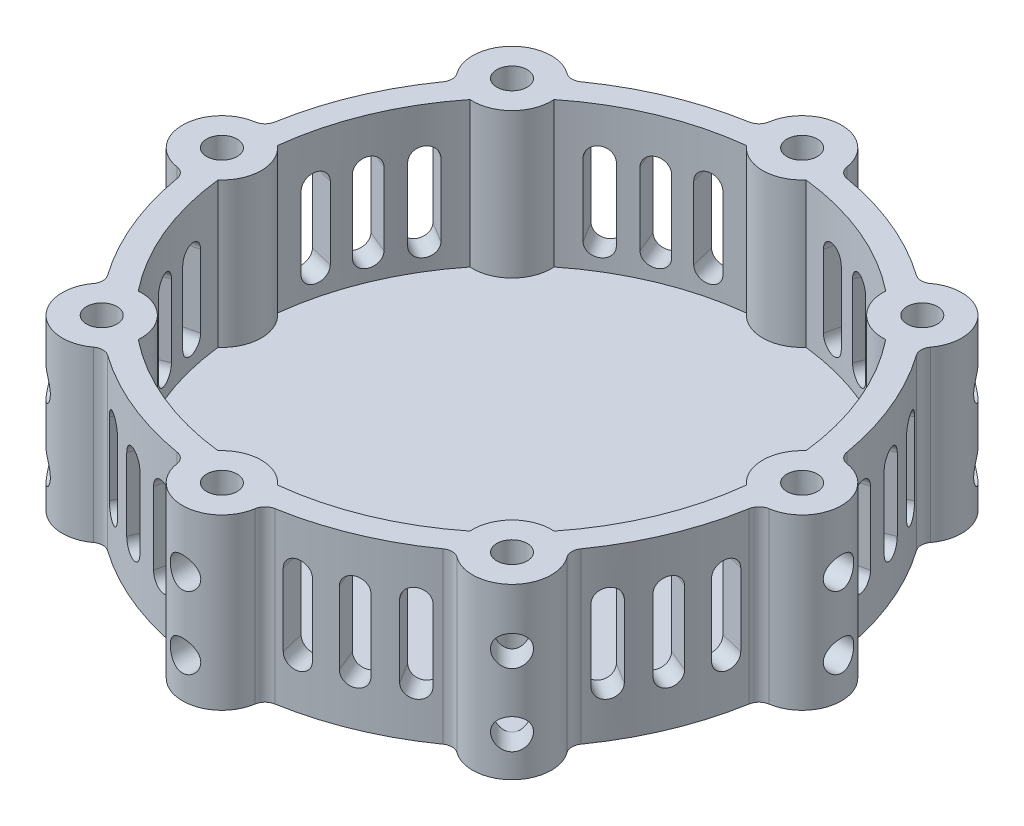
from build123d import *

# Parameters (mm, degrees)
BOSS_EXTRUDE1_DEPTH                 = 6.35
BOSS_EXTRUDE2_DEPTH                 = 38.1
CUT_EXTRUDE4_DEPTH                  = 15.999999877
CIRPATTERN6_COUNT                   = 8
CUT_EXTRUDE5_REACH                  = 196.514
CUT_EXTRUDE5_END_RADIUS             = 69.85
CUT_EXTRUDE5_DIRECTION_2_REACH      = 196.514
CUT_EXTRUDE5_DIRECTION_2_END_RADIUS = 76.2
CIRPATTERN7_COUNT                   = 2
CIRPATTERN7_ANGLE                   = 9
CIRPATTERN7_THE_OTHER_WAY_COUNT     = 2
CIRPATTERN7_THE_OTHER_WAY_ANGLE     = 9
CIRPATTERN8_START                   = 69.398331616
CIRPATTERN8_DEPTH                   = 7.601668384
CIRPATTERN8_START_2                 = 68.973146063
CIRPATTERN8_2_DEPTH                 = 8.026853937
CIRPATTERN8_START_3                 = 69.006751978
CIRPATTERN8_3_DEPTH                 = 7.993248022
CIRPATTERN8_START_4                 = -77
CIRPATTERN8_4_DEPTH                 = 154
CIRPATTERN8_5_DEPTH                 = 154
CIRPATTERN8_6_DEPTH                 = 154
CIRPATTERN8_7_DEPTH                 = 154
CIRPATTERN8_8_DEPTH                 = 154
CIRPATTERN8_9_DEPTH                 = 154
CIRPATTERN8_10_DEPTH                = 154
CIRPATTERN8_11_DEPTH                = 154
CIRPATTERN8_12_DEPTH                = 154


with BuildPart() as part:
    # Sketch9 → Boss-Extrude1 (new body)
    with BuildSketch(Plane(origin=(0, 0, 0), x_dir=(1, 0, 0), z_dir=(0, 1, 0))):
        with BuildLine():
            ThreePointArc((-10.231491372, 77.761756808), (-11.105207378, 76.015825656), (-12.835331785, 75.111212598))
            ThreePointArc((-12.835331785, 75.111212598), (-29.160477551, 70.399620375), (-44.035697637, 62.187597908))
            ThreePointArc((-44.035697637, 62.187597908), (-45.898738361, 61.603873243), (-47.751108625, 62.220622487))
            ThreePointArc((-47.751108625, 62.220622487), (-61.200091912, 61.200091912), (-62.220622487, 47.751108625))
            ThreePointArc((-62.220622487, 47.751108625), (-61.761905691, 46.860108439), (-61.603747828, 45.870518362))
            ThreePointArc((-61.603747828, 45.870518362), (-61.753229197, 44.907781631), (-62.187597915, 44.035697628))
            ThreePointArc((-62.187597915, 44.035697628), (-70.399620377, 29.160477547), (-75.111212598, 12.835331786))
            ThreePointArc((-75.111212598, 12.835331786), (-76.015825656, 11.105207379), (-77.761756808, 10.231491372))
            ThreePointArc((-77.761756808, 10.231491372), (-86.550000001, 0), (-77.761756808, -10.231491372))
            ThreePointArc((-77.761756808, -10.231491372), (-76.015825656, -11.105207378), (-75.111212598, -12.835331785))
            ThreePointArc((-75.111212598, -12.835331785), (-70.399620371, -29.160477561), (-62.187597896, -44.035697654))
            ThreePointArc((-62.187597896, -44.035697654), (-61.753229192, -44.907781647), (-61.603747828, -45.870518362))
            ThreePointArc((-61.603747828, -45.870518362), (-61.761905691, -46.860108439), (-62.220622487, -47.751108625))
            ThreePointArc((-62.220622487, -47.751108625), (-61.200091912, -61.200091912), (-47.751108625, -62.220622487))
            ThreePointArc((-47.751108625, -62.220622487), (-45.898738355, -61.603873243), (-44.035697628, -62.187597915))
            ThreePointArc((-44.035697628, -62.187597915), (-29.160477591, -70.399620359), (-12.83533188, -75.111212582))
            ThreePointArc((-12.83533188, -75.111212582), (-11.105207412, -76.015825622), (-10.231491372, -77.761756808))
            ThreePointArc((-10.231491372, -77.761756808), (0, -86.550000001), (10.231491372, -77.761756808))
            ThreePointArc((10.231491372, -77.761756808), (11.105207378, -76.015825656), (12.835331785, -75.111212598))
            ThreePointArc((12.835331785, -75.111212598), (29.160477513, -70.399620391), (44.035697569, -62.187597956))
            ThreePointArc((44.035697569, -62.187597956), (45.89873832, -61.603873243), (47.751108625, -62.220622487))
            ThreePointArc((47.751108625, -62.220622487), (61.200091912, -61.200091912), (62.220622487, -47.751108625))
            ThreePointArc((62.220622487, -47.751108625), (61.603873243, -45.898738355), (62.187597915, -44.035697628))
            ThreePointArc((62.187597915, -44.035697628), (70.399620388, -29.160477522), (75.111212607, -12.835331732))
            ThreePointArc((75.111212607, -12.835331732), (76.015825675, -11.10520736), (77.761756808, -10.231491372))
            ThreePointArc((77.761756808, -10.231491372), (86.550000001, 0), (77.761756808, 10.231491372))
            ThreePointArc((77.761756808, 10.231491372), (76.015825656, 11.105207378), (75.111212598, 12.835331785))
            ThreePointArc((75.111212598, 12.835331785), (70.3996203, 29.160477734), (62.18759768, 44.03569796))
            ThreePointArc((62.18759768, 44.03569796), (61.603873245, 45.898738559), (62.220622487, 47.751108625))
            ThreePointArc((62.220622487, 47.751108625), (61.200091912, 61.200091912), (47.751108625, 62.220622487))
            ThreePointArc((47.751108625, 62.220622487), (45.898738355, 61.603873243), (44.035697628, 62.187597915))
            ThreePointArc((44.035697628, 62.187597915), (29.160477452, 70.399620416), (12.835331584, 75.111212632))
            ThreePointArc((12.835331584, 75.111212632), (11.105207307, 76.015825729), (10.231491372, 77.761756808))
            ThreePointArc((10.231491372, 77.761756808), (0, 86.550000001), (-10.231491372, 77.761756808))
        make_face()
    extrude(amount=BOSS_EXTRUDE1_DEPTH)

    # Sketch10 → Boss-Extrude2 (add)
    with BuildSketch(Plane(origin=(0, 6.35, 0), x_dir=(1, 0, 0), z_dir=(0, 1, 0))):
        with BuildLine():
            ThreePointArc((-10.231491372, 77.761756808), (-11.105207378, 76.015825656), (-12.835331785, 75.111212598))
            ThreePointArc((-12.835331785, 75.111212598), (-29.160477551, 70.399620375), (-44.035697637, 62.187597908))
            ThreePointArc((-44.035697637, 62.187597908), (-45.898738361, 61.603873243), (-47.751108625, 62.220622487))
            ThreePointArc((-47.751108625, 62.220622487), (-61.200091912, 61.200091912), (-62.220622487, 47.751108625))
            ThreePointArc((-62.220622487, 47.751108625), (-61.761905691, 46.860108439), (-61.603747828, 45.870518362))
            ThreePointArc((-61.603747828, 45.870518362), (-61.753229197, 44.907781631), (-62.187597915, 44.035697628))
            ThreePointArc((-62.187597915, 44.035697628), (-70.399620377, 29.160477547), (-75.111212598, 12.835331786))
            ThreePointArc((-75.111212598, 12.835331786), (-76.015825656, 11.105207379), (-77.761756808, 10.231491372))
            ThreePointArc((-77.761756808, 10.231491372), (-86.550000001, 0), (-77.761756808, -10.231491372))
            ThreePointArc((-77.761756808, -10.231491372), (-76.015825656, -11.105207378), (-75.111212598, -12.835331785))
            ThreePointArc((-75.111212598, -12.835331785), (-70.399620375, -29.160477553), (-62.187597907, -44.035697639))
            ThreePointArc((-62.187597907, -44.035697639), (-61.753229195, -44.907781638), (-61.603747828, -45.870518362))
            ThreePointArc((-61.603747828, -45.870518362), (-61.761905691, -46.860108439), (-62.220622487, -47.751108625))
            ThreePointArc((-62.220622487, -47.751108625), (-61.200091912, -61.200091912), (-47.751108625, -62.220622487))
            ThreePointArc((-47.751108625, -62.220622487), (-45.898738355, -61.603873243), (-44.035697628, -62.187597915))
            ThreePointArc((-44.035697628, -62.187597915), (-29.160477591, -70.399620359), (-12.83533188, -75.111212582))
            ThreePointArc((-12.83533188, -75.111212582), (-11.105207412, -76.015825622), (-10.231491372, -77.761756808))
            ThreePointArc((-10.231491372, -77.761756808), (0, -86.550000001), (10.231491372, -77.761756808))
            ThreePointArc((10.231491372, -77.761756808), (11.105207378, -76.015825656), (12.835331785, -75.111212598))
            ThreePointArc((12.835331785, -75.111212598), (29.160477555, -70.399620374), (44.035697643, -62.187597904))
            ThreePointArc((44.035697643, -62.187597904), (45.898738364, -61.603873243), (47.751108625, -62.220622487))
            ThreePointArc((47.751108625, -62.220622487), (61.200091912, -61.200091912), (62.220622487, -47.751108625))
            ThreePointArc((62.220622487, -47.751108625), (61.603873243, -45.898738355), (62.187597915, -44.035697628))
            ThreePointArc((62.187597915, -44.035697628), (70.399620388, -29.160477522), (75.111212607, -12.835331732))
            ThreePointArc((75.111212607, -12.835331732), (76.015825675, -11.10520736), (77.761756808, -10.231491372))
            ThreePointArc((77.761756808, -10.231491372), (86.550000001, 0), (77.761756808, 10.231491372))
            ThreePointArc((77.761756808, 10.231491372), (76.015825656, 11.105207378), (75.111212598, 12.835331785))
            ThreePointArc((75.111212598, 12.835331785), (70.399620392, 29.160477512), (62.187597958, 44.035697567))
            ThreePointArc((62.187597958, 44.035697567), (61.603873243, 45.898738318), (62.220622487, 47.751108625))
            ThreePointArc((62.220622487, 47.751108625), (61.200091912, 61.200091912), (47.751108625, 62.220622487))
            ThreePointArc((47.751108625, 62.220622487), (45.898738355, 61.603873243), (44.035697628, 62.187597915))
            ThreePointArc((44.035697628, 62.187597915), (29.160477452, 70.399620416), (12.835331584, 75.111212632))
            ThreePointArc((12.835331584, 75.111212632), (11.105207307, 76.015825729), (10.231491372, 77.761756808))
            ThreePointArc((10.231491372, 77.761756808), (0, 86.550000001), (-10.231491372, 77.761756808))
        make_face()
        with BuildLine():
            ThreePointArc((-49.881536725, -53.881536726), (-55.460640405, -57.556646464), (-56.634752514, -50.979847074))
            ThreePointArc((-56.634752514, -50.979847074), (-52.302433048, -50.206426989), (-49.881536725, -53.881536726))
        make_face(mode=Mode.SUBTRACT)
        with BuildLine():
            ThreePointArc((4.000000001, -76.2), (-0.05249796, -80.199655482), (-3.998621983, -76.095013123))
            ThreePointArc((-3.998621983, -76.095013123), (0.05249796, -72.200344518), (4.000000001, -76.2))
        make_face(mode=Mode.SUBTRACT)
        with BuildLine():
            ThreePointArc((57.881536727, -53.881536726), (55.363636824, -57.596826663), (50.979847074, -56.634752514))
            ThreePointArc((50.979847074, -56.634752514), (52.399436629, -50.16624679), (57.881536727, -53.881536726))
        make_face(mode=Mode.SUBTRACT)
        with BuildLine():
            ThreePointArc((-43.556923847, 54.606015099), (-26.730437751, 64.532985346), (-7.81288735, 69.41167979))
            ThreePointArc((-7.81288735, 69.41167979), (0, 65.849999999), (7.81288735, 69.41167979))
            ThreePointArc((7.81288735, 69.41167979), (26.730437751, 64.532985346), (43.556923847, 54.606015099))
            ThreePointArc((43.556923847, 54.606015099), (46.56298154, 46.56298154), (54.606015099, 43.556923847))
            ThreePointArc((54.606015099, 43.556923847), (64.532985346, 26.730437751), (69.41167979, 7.81288735))
            ThreePointArc((69.41167979, 7.81288735), (65.849999999, 0), (69.41167979, -7.81288735))
            ThreePointArc((69.41167979, -7.81288735), (64.532985346, -26.730437751), (54.606015099, -43.556923847))
            ThreePointArc((54.606015099, -43.556923847), (46.56298154, -46.56298154), (43.556923847, -54.606015099))
            ThreePointArc((43.556923847, -54.606015099), (26.730437751, -64.532985346), (7.81288735, -69.41167979))
            ThreePointArc((7.81288735, -69.41167979), (0, -65.849999999), (-7.81288735, -69.41167979))
            ThreePointArc((-7.81288735, -69.41167979), (-26.730437751, -64.532985346), (-43.556923847, -54.606015099))
            ThreePointArc((-43.556923847, -54.606015099), (-46.56298154, -46.56298154), (-54.606015099, -43.556923847))
            ThreePointArc((-54.606015099, -43.556923847), (-64.532985346, -26.730437751), (-69.41167979, -7.81288735))
            ThreePointArc((-69.41167979, -7.81288735), (-65.849999999, 0), (-69.41167979, 7.81288735))
            ThreePointArc((-69.41167979, 7.81288735), (-64.532985346, 26.730437751), (-54.606015099, 43.556923847))
            ThreePointArc((-54.606015099, 43.556923847), (-46.56298154, 46.56298154), (-43.556923847, 54.606015099))
        make_face(mode=Mode.SUBTRACT)
        with BuildLine():
            ThreePointArc((80.200000001, 0), (78.99106185, -2.865305177), (76.095013123, -3.998621983))
            ThreePointArc((76.095013123, -3.998621983), (73.40893815, 2.865305177), (80.200000001, 0))
        make_face(mode=Mode.SUBTRACT)
        with BuildLine():
            ThreePointArc((-72.199999999, 0), (-79.065305177, -2.79106185), (-76.095013123, 3.998621983))
            ThreePointArc((-76.095013123, 3.998621983), (-73.334694823, 2.79106185), (-72.199999999, 0))
        make_face(mode=Mode.SUBTRACT)
        with BuildLine():
            ThreePointArc((-49.881536725, 53.881536726), (-57.596826663, 52.399436629), (-50.979847074, 56.634752514))
            ThreePointArc((-50.979847074, 56.634752514), (-50.16624679, 55.363636824), (-49.881536725, 53.881536726))
        make_face(mode=Mode.SUBTRACT)
        with BuildLine():
            ThreePointArc((4.000000001, 76.2), (3.999655482, 76.14750204), (3.998621983, 76.095013123))
            ThreePointArc((3.998621983, 76.095013123), (-3.999655482, 76.25249796), (4.000000001, 76.2))
        make_face(mode=Mode.SUBTRACT)
        with BuildLine():
            ThreePointArc((57.881536727, 53.881536726), (57.556646464, 52.302433048), (56.634752514, 50.979847074))
            ThreePointArc((56.634752514, 50.979847074), (50.206426989, 55.460640405), (57.881536727, 53.881536726))
        make_face(mode=Mode.SUBTRACT)
    extrude(amount=BOSS_EXTRUDE2_DEPTH)

    # Sketch13 → Cut-Extrude4 (cut)
    with BuildSketch(Plane.XY.offset(-86.550000001)):
        with BuildLine():
            ThreePointArc((0, 33.274999998), (-4.000000001, 29.274999997), (0, 25.274999996))
            Line((0, 25.274999996), (0, 33.274999998))
        make_face()
        with BuildLine():
            Line((0, 33.274999998), (0, 25.274999996))
            ThreePointArc((0, 25.274999996), (2.828427125, 26.446572872), (4.000000001, 29.274999997))
            ThreePointArc((4.000000001, 29.274999997), (2.828427125, 32.103427122), (0, 33.274999998))
        make_face()
        with BuildLine():
            ThreePointArc((0, 14.350000002), (-4.000000001, 10.350000001), (0, 6.35))
            Line((0, 6.35), (0, 14.350000002))
        make_face()
        with BuildLine():
            Line((0, 14.350000002), (0, 6.35))
            ThreePointArc((0, 6.35), (2.828427125, 7.521572876), (4.000000001, 10.350000001))
            ThreePointArc((4.000000001, 10.350000001), (2.828427125, 13.178427126), (0, 14.350000002))
        make_face()
    cut_extrude4 = extrude(amount=CUT_EXTRUDE4_DEPTH, mode=Mode.SUBTRACT)

    # CirPattern6: Cut-Extrude4 ×8 about axis
    cirpattern6_axis = Axis((0, 44.45, 0), (0, -1, 0))
    for i in range(1, CIRPATTERN6_COUNT):
        add(cut_extrude4.rotate(cirpattern6_axis, i * 360 / CIRPATTERN6_COUNT), mode=Mode.SUBTRACT)

    # Cut-Extrude5: up to this cylinder (the profile starts outside it)
    cut_extrude5_end = Plane(origin=(0, 22.225, 0), z_dir=(0, -1, 0)) * Cylinder(CUT_EXTRUDE5_END_RADIUS, 533.728, mode=Mode.PRIVATE)
    # Sketch17 → Cut-Extrude5 (cut, up to the surface)
    with BuildSketch(Plane(origin=(-26.940768363, 0, -65.040768363), x_dir=(-0.9238795325112878, 0, 0.3826834323650873), z_dir=(-0.3826834323650873, 0, -0.9238795325112878)), mode=Mode.PRIVATE) as cut_extrude5_sk1:
        with BuildLine():
            Line((-3.175, 12.7), (-3.175, 31.75))
            ThreePointArc((-3.175, 31.75), (0, 34.925), (3.175, 31.75))
            Line((3.175, 31.75), (3.175, 12.7))
            ThreePointArc((3.175, 12.7), (0, 9.525), (-3.175, 12.7))
        make_face()
    cut_extrude5_tool1 = extrude(cut_extrude5_sk1.sketch, amount=-CUT_EXTRUDE5_REACH, mode=Mode.PRIVATE) - cut_extrude5_end
    cut_extrude5 = cut_extrude5_tool1.solids().sort_by_distance((-26.940768, 22.225, -65.040768))[0]
    add(cut_extrude5, mode=Mode.SUBTRACT)

    # Cut-Extrude5 direction 2: up to this cylinder (the profile starts inside it)
    cut_extrude5_direction_2_end = Plane(origin=(0, 22.225, 0), z_dir=(0, -1, 0)) * Cylinder(CUT_EXTRUDE5_DIRECTION_2_END_RADIUS, 546.428, mode=Mode.PRIVATE)
    # Sketch17 → Cut-Extrude5 direction 2 (cut, up to the surface)
    with BuildSketch(Plane(origin=(-26.940768363, 0, -65.040768363), x_dir=(-0.9238795325112878, 0, 0.3826834323650873), z_dir=(-0.3826834323650873, 0, -0.9238795325112878)), mode=Mode.PRIVATE) as cut_extrude5_direction_2_sk1:
        with BuildLine():
            Line((-3.175, 12.7), (-3.175, 31.75))
            ThreePointArc((-3.175, 31.75), (0, 34.925), (3.175, 31.75))
            Line((3.175, 31.75), (3.175, 12.7))
            ThreePointArc((3.175, 12.7), (0, 9.525), (-3.175, 12.7))
        make_face()
    cut_extrude5_direction_2_tool1 = extrude(cut_extrude5_direction_2_sk1.sketch, amount=CUT_EXTRUDE5_DIRECTION_2_REACH, mode=Mode.PRIVATE) & cut_extrude5_direction_2_end
    cut_extrude5_direction_2 = cut_extrude5_direction_2_tool1.solids().sort_by_distance((-26.940768, 22.225, -65.040768))[0]
    add(cut_extrude5_direction_2, mode=Mode.SUBTRACT)
    cut_extrude5 = cut_extrude5 + cut_extrude5_direction_2  # both directions under the feature's name, for the pattern or mirror that repeats it

    # CirPattern7: Cut-Extrude5 ×2 about axis
    cirpattern7_axis = Axis((0, 44.45, 0), (0, -1, 0))
    for i in range(1, CIRPATTERN7_COUNT):
        add(cut_extrude5.rotate(cirpattern7_axis, i * CIRPATTERN7_ANGLE / (CIRPATTERN7_COUNT - 1)), mode=Mode.SUBTRACT)

    # CirPattern7 the other way: Cut-Extrude5 ×2 about axis
    cirpattern7_the_other_way_axis = Axis((0, 44.45, 0), (0, 1, 0))
    for i in range(1, CIRPATTERN7_THE_OTHER_WAY_COUNT):
        add(cut_extrude5.rotate(cirpattern7_the_other_way_axis, i * CIRPATTERN7_THE_OTHER_WAY_ANGLE / (CIRPATTERN7_THE_OTHER_WAY_COUNT - 1)), mode=Mode.SUBTRACT)

    # CirPattern8: read off the stored shape, not the designer's step
    # CirPattern8 outline → CirPattern8 (cut)
    with BuildSketch(Plane(origin=(0, 0, 0), x_dir=(0.923879532511288, 0, -0.38268343236508706), z_dir=(0.382683432365087, 0, 0.923879532511288)).offset(CIRPATTERN8_START)):
        with BuildLine():
            ThreePointArc((-3.175, 12.7), (0, 9.525), (3.175, 12.7))
            Line((3.175, 12.7), (3.175, 31.75))
            ThreePointArc((3.175, 31.75), (0, 34.925), (-3.175, 31.75))
            Line((-3.175, 31.75), (-3.175, 12.7))
        make_face()
    extrude(amount=CIRPATTERN8_DEPTH, mode=Mode.SUBTRACT)

    # CirPattern8 2 outline → CirPattern8 2 (cut)
    with BuildSketch(Plane(origin=(0, 0, 0), x_dir=(0.8526401643540932, 0, -0.5224985647159472), z_dir=(0.5224985647159472, 0, 0.8526401643540933)).offset(CIRPATTERN8_START_2)):
        with BuildLine():
            ThreePointArc((-3.175, 12.7), (0, 9.525), (3.175, 12.7))
            Line((3.175, 12.7), (3.175, 31.75))
            ThreePointArc((3.175, 31.75), (0, 34.925), (-3.175, 31.75))
            Line((-3.175, 31.75), (-3.175, 12.7))
        make_face()
    extrude(amount=CIRPATTERN8_2_DEPTH, mode=Mode.SUBTRACT)

    # CirPattern8 3 outline → CirPattern8 3 (cut)
    with BuildSketch(Plane(origin=(0, 0, 0), x_dir=(0.9723699203976774, 0, -0.23344536385590214), z_dir=(0.23344536385590212, 0, 0.9723699203976774)).offset(CIRPATTERN8_START_3)):
        with BuildLine():
            ThreePointArc((-3.175, 12.7), (0, 9.525), (3.175, 12.7))
            Line((3.175, 12.7), (3.175, 31.75))
            ThreePointArc((3.175, 31.75), (0, 34.925), (-3.175, 31.75))
            Line((-3.175, 31.75), (-3.175, 12.7))
        make_face()
    extrude(amount=CIRPATTERN8_3_DEPTH, mode=Mode.SUBTRACT)

    # CirPattern8 4 outline → CirPattern8 4 (cut)
    with BuildSketch(Plane(origin=(0, 0, 0), x_dir=(0.9238795325112851, 0, 0.3826834323650941), z_dir=(0.38268343236509406, 0, -0.9238795325112851)).offset(CIRPATTERN8_START_4)):
        with BuildLine():
            ThreePointArc((3.175, -12.7), (0, -9.525), (-3.175, -12.7))
            Line((-3.175, -12.7), (-3.175, -31.75))
            ThreePointArc((-3.175, -31.75), (0, -34.925), (3.175, -31.75))
            Line((3.175, -31.75), (3.175, -12.7))
        make_face()
    extrude(amount=CIRPATTERN8_4_DEPTH, mode=Mode.SUBTRACT)

    # CirPattern8 5 outline → CirPattern8 5 (cut)
    with BuildSketch(Plane(origin=(0, 0, 0), x_dir=(0.8526401643540897, 0, 0.5224985647159529), z_dir=(0.5224985647159529, 0, -0.8526401643540897)).offset(CIRPATTERN8_START_4)):
        with BuildLine():
            ThreePointArc((3.175, -12.7), (0, -9.525), (-3.175, -12.7))
            Line((-3.175, -12.7), (-3.175, -31.75))
            ThreePointArc((-3.175, -31.75), (0, -34.925), (3.175, -31.75))
            Line((3.175, -31.75), (3.175, -12.7))
        make_face()
    extrude(amount=CIRPATTERN8_5_DEPTH, mode=Mode.SUBTRACT)

    # CirPattern8 6 outline → CirPattern8 6 (cut)
    with BuildSketch(Plane(origin=(0, 0, 0), x_dir=(0.9723699203976757, 0, 0.23344536385590892), z_dir=(0.23344536385590894, 0, -0.9723699203976758)).offset(CIRPATTERN8_START_4)):
        with BuildLine():
            ThreePointArc((3.175, -12.7), (0, -9.525), (-3.175, -12.7))
            Line((-3.175, -12.7), (-3.175, -31.75))
            ThreePointArc((-3.175, -31.75), (0, -34.925), (3.175, -31.75))
            Line((3.175, -31.75), (3.175, -12.7))
        make_face()
    extrude(amount=CIRPATTERN8_6_DEPTH, mode=Mode.SUBTRACT)

    # CirPattern8 7 outline → CirPattern8 7 (cut)
    with BuildSketch(Plane(origin=(0, 0, 0), x_dir=(0, 1, 0), z_dir=(0.9238795325112892, 0, -0.3826834323650841)).offset(CIRPATTERN8_START_4)):
        with BuildLine():
            ThreePointArc((12.7, 3.175), (9.525, 0), (12.7, -3.175))
            Line((12.7, -3.175), (31.75, -3.175))
            ThreePointArc((31.75, -3.175), (34.925, 0), (31.75, 3.175))
            Line((31.75, 3.175), (12.7, 3.175))
        make_face()
    extrude(amount=CIRPATTERN8_7_DEPTH, mode=Mode.SUBTRACT)

    # CirPattern8 8 outline → CirPattern8 8 (cut)
    with BuildSketch(Plane(origin=(0, 0, 0), x_dir=(0, 1, 0), z_dir=(0.9723699203976781, 0, -0.23344536385589904)).offset(CIRPATTERN8_START_4)):
        with BuildLine():
            ThreePointArc((12.7, 3.175), (9.525, 0), (12.7, -3.175))
            Line((12.7, -3.175), (31.75, -3.175))
            ThreePointArc((31.75, -3.175), (34.925, 0), (31.75, 3.175))
            Line((31.75, 3.175), (12.7, 3.175))
        make_face()
    extrude(amount=CIRPATTERN8_8_DEPTH, mode=Mode.SUBTRACT)

    # CirPattern8 9 outline → CirPattern8 9 (cut)
    with BuildSketch(Plane(origin=(0, 0, 0), x_dir=(0.5224985647159439, 0, 0.8526401643540952), z_dir=(0.8526401643540952, 0, -0.5224985647159441)).offset(CIRPATTERN8_START_4)):
        with BuildLine():
            ThreePointArc((3.175, -12.7), (0, -9.525), (-3.175, -12.7))
            Line((-3.175, -12.7), (-3.175, -31.75))
            ThreePointArc((-3.175, -31.75), (0, -34.925), (3.175, -31.75))
            Line((3.175, -31.75), (3.175, -12.7))
        make_face()
    extrude(amount=CIRPATTERN8_9_DEPTH, mode=Mode.SUBTRACT)

    # CirPattern8 10 outline → CirPattern8 10 (cut)
    with BuildSketch(Plane(origin=(0, 0, 0), x_dir=(0, 1, 0), z_dir=(0.9238795325112839, 0, 0.38268343236509694)).offset(CIRPATTERN8_START_4)):
        with BuildLine():
            ThreePointArc((12.7, 3.175), (9.525, 0), (12.7, -3.175))
            Line((12.7, -3.175), (31.75, -3.175))
            ThreePointArc((31.75, -3.175), (34.925, 0), (31.75, 3.175))
            Line((31.75, 3.175), (12.7, 3.175))
        make_face()
    extrude(amount=CIRPATTERN8_10_DEPTH, mode=Mode.SUBTRACT)

    # CirPattern8 11 outline → CirPattern8 11 (cut)
    with BuildSketch(Plane(origin=(0, 0, 0), x_dir=(0.5224985647159557, 0, -0.8526401643540881), z_dir=(0.852640164354088, 0, 0.522498564715956)).offset(CIRPATTERN8_START_4)):
        with BuildLine():
            ThreePointArc((-3.175, 12.7), (0, 9.525), (3.175, 12.7))
            Line((3.175, 12.7), (3.175, 31.75))
            ThreePointArc((3.175, 31.75), (0, 34.925), (-3.175, 31.75))
            Line((-3.175, 31.75), (-3.175, 12.7))
        make_face()
    extrude(amount=CIRPATTERN8_11_DEPTH, mode=Mode.SUBTRACT)

    # CirPattern8 12 outline → CirPattern8 12 (cut)
    with BuildSketch(Plane(origin=(0, 0, 0), x_dir=(0, 1, 0), z_dir=(0.9723699203976749, 0, 0.23344536385591297)).offset(CIRPATTERN8_START_4)):
        with BuildLine():
            ThreePointArc((12.7, 3.175), (9.525, 0), (12.7, -3.175))
            Line((12.7, -3.175), (31.75, -3.175))
            ThreePointArc((31.75, -3.175), (34.925, 0), (31.75, 3.175))
            Line((31.75, 3.175), (12.7, 3.175))
        make_face()
    extrude(amount=CIRPATTERN8_12_DEPTH, mode=Mode.SUBTRACT)


solid = part.part
